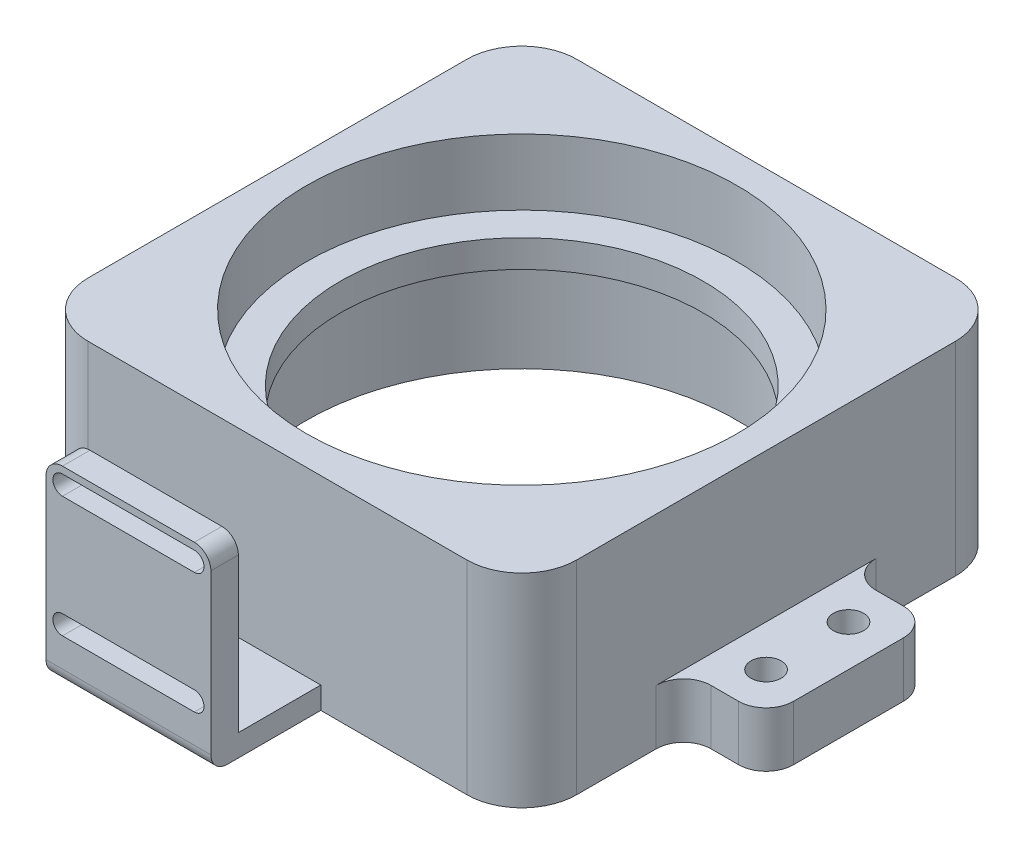
from build123d import *

# Parameters (mm, degrees)
SKETCH1_W           = 88.9
SKETCH1_H           = 88.9
SKETCH1_R           = 39.15
BOSS_EXTRUDE1_DEPTH = 20
SKETCH2_W           = 88.9
SKETCH2_H           = 88.9
SKETCH2_R           = 33
BOSS_EXTRUDE3_DEPTH = 5
SKETCH3_W           = 88.9
SKETCH3_H           = 88.9
SKETCH3_R           = 39.15
BOSS_EXTRUDE4_DEPTH = 12
SKETCH4_W           = 15
SKETCH4_H           = 30
SKETCH4_R           = 2.75
BOSS_EXTRUDE5_DEPTH = 10
FILLET1_R           = 5
FILLET2_R           = 10
SKETCH5_W           = 30
SKETCH5_H           = 4
BOSS_EXTRUDE6_DEPTH = 15
SKETCH6_W           = 30
SKETCH6_H           = 35
BOSS_EXTRUDE7_DEPTH = 5
FILLET3_R           = 3


with BuildPart() as part:
    # Sketch1 → Boss-Extrude1 (new body)
    with BuildSketch(Plane(origin=(0, 0, 0), x_dir=(1, 0, 0), z_dir=(0, 1, 0))):
        with Locations((44.45, 44.45)):
            Rectangle(SKETCH1_W, SKETCH1_H)
        with Locations((44.45, 44.45)):
            Circle(SKETCH1_R, mode=Mode.SUBTRACT)
    extrude(amount=BOSS_EXTRUDE1_DEPTH)

    # Sketch2 → Boss-Extrude3 (add)
    with BuildSketch(Plane(origin=(0, 20, 0), x_dir=(1, 0, 0), z_dir=(0, 1, 0))):
        with Locations((44.45, 44.45)):
            Rectangle(SKETCH2_W, SKETCH2_H)
        with Locations((44.45, 44.45)):
            Circle(SKETCH2_R, mode=Mode.SUBTRACT)
    extrude(amount=BOSS_EXTRUDE3_DEPTH)

    # Sketch3 → Boss-Extrude4 (add)
    with BuildSketch(Plane(origin=(0, 25, 0), x_dir=(1, 0, 0), z_dir=(0, 1, 0))):
        with Locations((44.45, 44.45)):
            Rectangle(SKETCH3_W, SKETCH3_H)
        with Locations((44.45, 44.45)):
            Circle(SKETCH3_R, mode=Mode.SUBTRACT)
    extrude(amount=BOSS_EXTRUDE4_DEPTH)

    # Sketch4 → Boss-Extrude5 (add)
    # profile 1 of 2: a face of its own
    with BuildSketch(Plane.XZ):
        with Locations((-7.5, -44.45)):
            Rectangle(SKETCH4_W, SKETCH4_H)
        with Locations((-7.5, -51.95)):
            Circle(SKETCH4_R, mode=Mode.SUBTRACT)
        with Locations((-7.5, -36.95)):
            Circle(SKETCH4_R, mode=Mode.SUBTRACT)
    # profile 2 of 2: a face of its own
    with BuildSketch(Plane.XZ):
        with Locations((96.4, -44.45)):
            Rectangle(SKETCH4_W, SKETCH4_H)
        with Locations((96.4, -36.95)):
            Circle(SKETCH4_R, mode=Mode.SUBTRACT)
        with Locations((96.4, -51.95)):
            Circle(SKETCH4_R, mode=Mode.SUBTRACT)
    extrude(amount=-BOSS_EXTRUDE5_DEPTH)

    # Fillet1
    fillet1_edges = [part.edges().sort_by_distance(p)[0] for p in [
        (88.9, 5, -59.45),
        (103.9, 5, -59.45),
        (103.9, 5, -29.45),
        (88.9, 5, -29.45),
        (-15, 5, -59.45),
        (0, 5, -59.45),
        (-15, 5, -29.45),
        (0, 5, -29.45),
    ]]
    fillet(fillet1_edges, radius=FILLET1_R)

    # Fillet2
    fillet2_edges = [part.edges().sort_by_distance(p)[0] for p in [
        (0, 18.5, 0),
        (88.9, 18.5, 0),
        (88.9, 18.5, -88.9),
        (0, 18.5, -88.9),
    ]]
    fillet(fillet2_edges, radius=FILLET2_R)

    # Sketch5 → Boss-Extrude6 (add)
    with BuildSketch(Plane.XY):
        with Locations((37.32503103, 2)):
            Rectangle(SKETCH5_W, SKETCH5_H)
    extrude(amount=BOSS_EXTRUDE6_DEPTH)

    # Sketch6 → Boss-Extrude7 (add)
    with BuildSketch(Plane.XY.offset(15)):
        with Locations((37.32503103, 17.5)):
            Rectangle(SKETCH6_W, SKETCH6_H)
        with BuildLine():
            Line((25.32503103, 33.75), (49.32503103, 33.75))
            ThreePointArc((49.32503103, 33.75), (51.07503103, 32), (49.32503103, 30.25))
            Line((49.32503103, 30.25), (25.32503103, 30.25))
            ThreePointArc((25.32503103, 30.25), (23.57503103, 32), (25.32503103, 33.75))
        make_face(mode=Mode.SUBTRACT)
        with BuildLine():
            ThreePointArc((25.32503103, 8.25), (23.57503103, 10), (25.32503103, 11.75))
            Line((25.32503103, 11.75), (49.32503103, 11.75))
            ThreePointArc((49.32503103, 11.75), (51.07503103, 10), (49.32503103, 8.25))
            Line((49.32503103, 8.25), (25.32503103, 8.25))
        make_face(mode=Mode.SUBTRACT)
    extrude(amount=BOSS_EXTRUDE7_DEPTH)

    # Fillet3
    fillet3_edges = [part.edges().sort_by_distance(p)[0] for p in [
        (37.32503103, 0, 20),
        (22.32503103, 35, 17.5),
        (52.32503103, 35, 17.5),
    ]]
    fillet(fillet3_edges, radius=FILLET3_R)


solid = part.part
